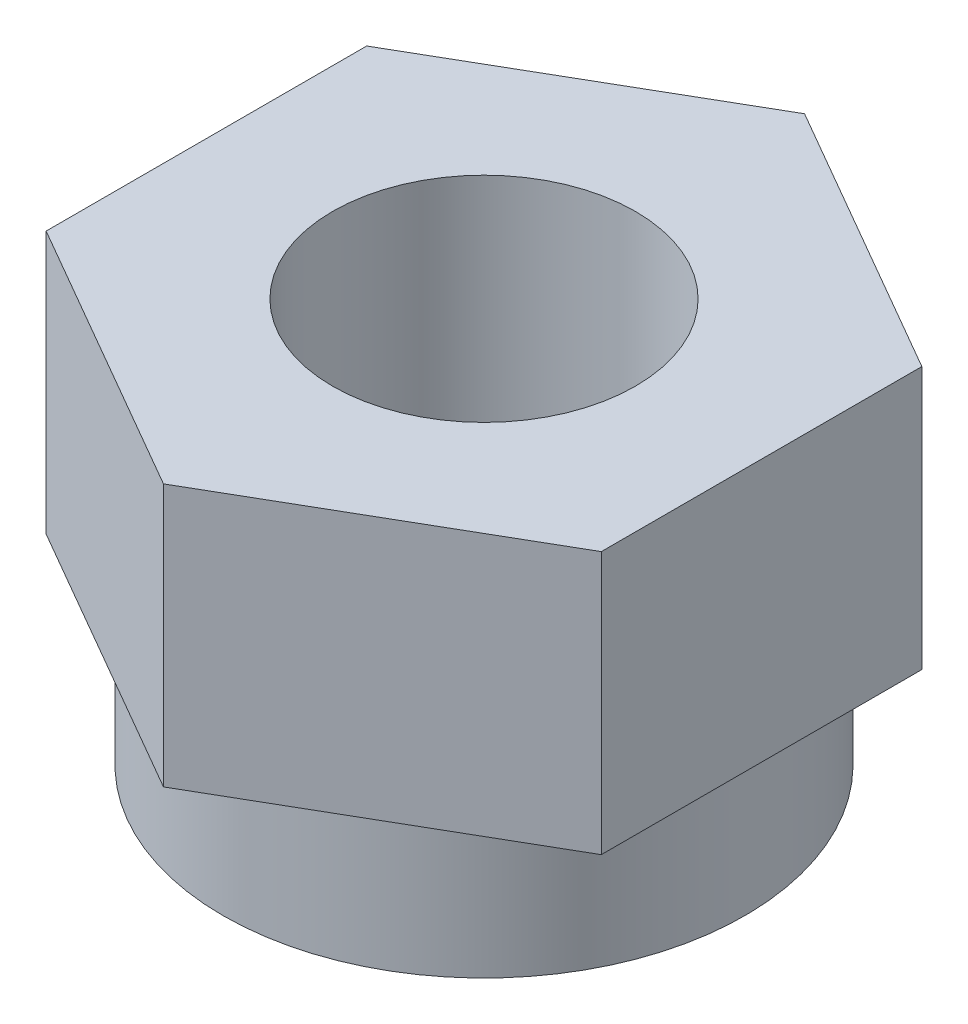
from build123d import *

# Parameters (mm, degrees)
BOSS_EXTRUDE1_DEPTH     = 2.6
SKETCH2_R               = 2.585
BOSS_EXTRUDE2_DEPTH     = 1.4
CUT_EXTRUDE1_DEPTH      = 6.800502852
CUT_EXTRUDE1_DEPTH_BACK = 6.800502852
SKETCH3_R               = 1.5


with BuildPart() as part:
    # Sketch1 → Boss-Extrude1 (new body)
    with BuildSketch(Plane(origin=(0, 0, 0), x_dir=(1, 0, 0), z_dir=(0, 1, 0))):
        Polygon((2.75, -1.58771324), (0, -3.175426481), (-2.75, -1.58771324), (-2.75, 1.58771324), (0, 3.175426481), (2.75, 1.58771324), align=None)
    extrude(amount=-BOSS_EXTRUDE1_DEPTH)

    # Sketch2 → Boss-Extrude2 (add)
    with BuildSketch(Plane(origin=(0, -2.6, 0), x_dir=(1, 0, 0), z_dir=(0, 1, 0))):
        Circle(SKETCH2_R)
    extrude(amount=-BOSS_EXTRUDE2_DEPTH)

    # Sketch3 → Cut-Extrude1 (cut, two sides: drawn at the far end of the back side and taken through both)
    with BuildSketch(Plane(origin=(0, 0, 0), x_dir=(1, 0, 0), z_dir=(0, 1, 0)).offset(-CUT_EXTRUDE1_DEPTH_BACK)):
        Circle(SKETCH3_R)
    extrude(amount=CUT_EXTRUDE1_DEPTH + CUT_EXTRUDE1_DEPTH_BACK, mode=Mode.SUBTRACT)


solid = part.part
